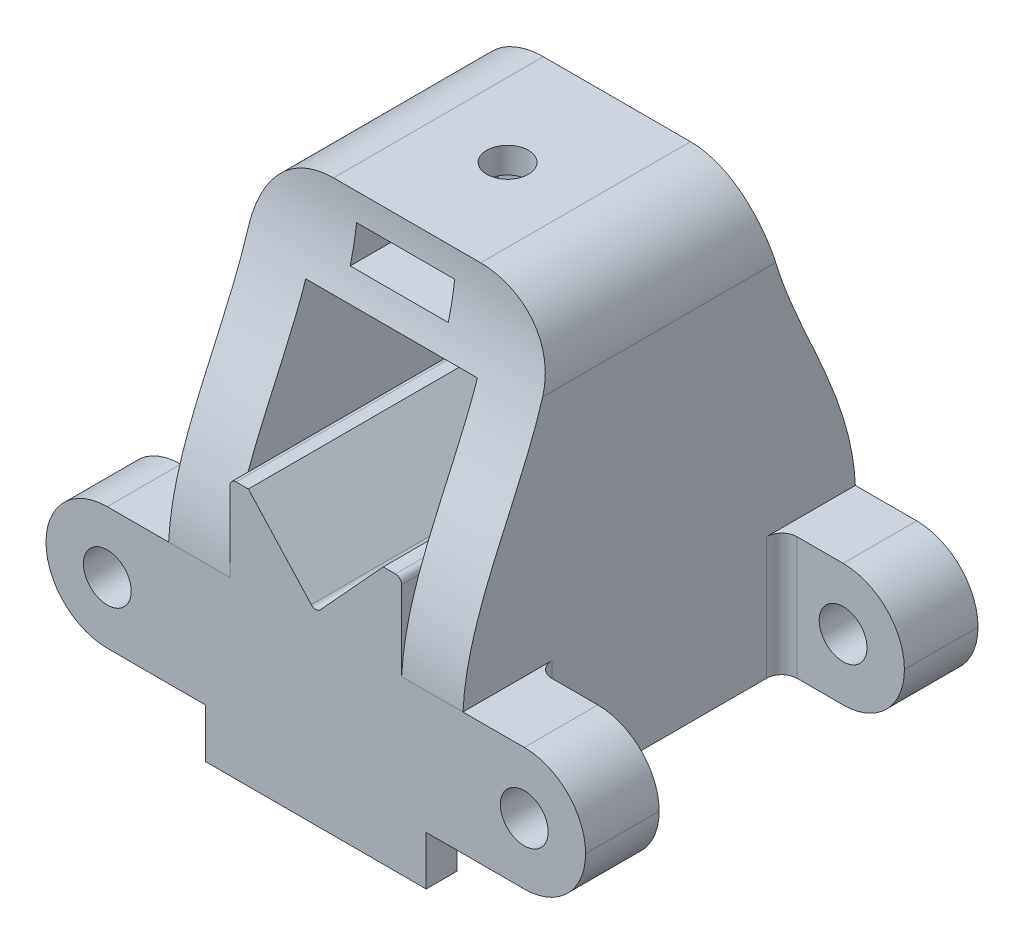
from build123d import *

# Parameters (mm, degrees)
BOSS_EXTRUDE1_DEPTH = 10
SKETCH2_W           = 5
SKETCH2_H           = 32
BOSS_EXTRUDE2_DEPTH = 18
SKETCH3_W           = 24
SKETCH3_H           = 20
BOSS_EXTRUDE3_DEPTH = 7
CUT_EXTRUDE1_DEPTH  = 56.290143787
BOSS_EXTRUDE4_REACH = 56.194
SKETCH7_R           = 1.7
CUT_EXTRUDE2_DEPTH  = 7
SKETCH6_W           = 8
SKETCH6_H           = 2.8
CUT_EXTRUDE3_DEPTH  = 13.34
SKETCH8_R           = 1.95
CUT_EXTRUDE4_DEPTH  = 55.194244669
FILLET1_R           = 5
FILLET2_R           = 1.25
FILLET3_R           = 6
SKETCH9_W           = 18
SKETCH9_H           = 2.5
BOSS_EXTRUDE5_DEPTH = 4
FILLET4_R           = 1


with BuildPart() as part:
    # Sketch1 → Boss-Extrude1 (new body)
    with BuildSketch(Plane(origin=(0, 0, 0), x_dir=(1, 0, 0), z_dir=(0, 1, 0))):
        Polygon((-17.769938204, -26), (-17.769938204, -20), (-7.769938204, -20), (-7.769938204, 0), (-17.769938204, 0), (-17.769938204, 6), (26.230061796, 6), (26.230061796, 0), (16.230061796, 0), (16.230061796, -20), (26.230061796, -20), (26.230061796, -26), align=None)
    extrude(amount=BOSS_EXTRUDE1_DEPTH)

    # Sketch2 → Boss-Extrude2 (add)
    with BuildSketch(Plane(origin=(0, 10, 0), x_dir=(1, 0, 0), z_dir=(0, 1, 0))):
        with Locations((-5.269938204, -10)):
            Rectangle(SKETCH2_W, SKETCH2_H)
        with Locations((13.730061796, -10)):
            Rectangle(SKETCH2_W, SKETCH2_H)
    extrude(amount=BOSS_EXTRUDE2_DEPTH)

    # Sketch3 → Boss-Extrude3 (add)
    with BuildSketch(Plane(origin=(0, 28, 0), x_dir=(1, 0, 0), z_dir=(0, 1, 0))):
        with Locations((4.230061796, -10)):
            Rectangle(SKETCH3_W, SKETCH3_H)
    extrude(amount=BOSS_EXTRUDE3_DEPTH)

    # Sketch4 → Cut-Extrude1 (cut, through all)
    with BuildSketch(Plane(origin=(16.230061796, 0, 0), x_dir=(0, 0, -1), z_dir=(1, 0, 0))):
        with BuildLine():
            Line((-26, 10), (-26, 35))
            Line((-26, 35), (-18.555107994, 35))
            add(Edge.make_bspline(
                [(-26, 10), (-25.555357091, 18.878891188), (-18.529592831, 25.955762579), (-18.555107994, 35)],
                knots=[0, 0, 0, 0, 1, 1, 1, 1], degree=3))
        make_face()
        with BuildLine():
            Line((6, 10), (6, 35))
            Line((6, 35), (-1.444892006, 35))
            add(Edge.make_bspline(
                [(6, 10), (5.555357091, 18.878891188), (-1.470407169, 25.955762579), (-1.444892006, 35)],
                knots=[0, 0, 0, 0, 1, 1, 1, 1], degree=3))
        make_face()
    extrude(amount=-CUT_EXTRUDE1_DEPTH, mode=Mode.SUBTRACT)

    # Boss-Extrude4: up to this face of the body (flat: up to its plane)
    boss_extrude4_end = Plane(part.part.faces().sort_by_distance((4.230061796, 5, -6))[0])
    # Sketch5 → Boss-Extrude4 (add, up to the picked face)
    with BuildSketch(Plane.XY.offset(26), mode=Mode.PRIVATE) as boss_extrude4_sk1:
        with BuildLine():
            Line((-2.769938204, 10), (11.230061796, 10))
            Line((11.230061796, 10), (11.230061796, 16.5))
            ThreePointArc((11.230061796, 16.5), (11.083615187, 16.853553391), (10.730061796, 17))
            Line((10.730061796, 17), (9.730061796, 17))
            Line((9.730061796, 17), (4.598638866, 11.402084076))
            ThreePointArc((4.598638866, 11.402084076), (4.230061796, 11.239946391), (3.861484726, 11.402084076))
            Line((3.861484726, 11.402084076), (-1.269938204, 17))
            Line((-1.269938204, 17), (-2.269938204, 17))
            ThreePointArc((-2.269938204, 17), (-2.623491594, 16.853553391), (-2.769938204, 16.5))
            Line((-2.769938204, 16.5), (-2.769938204, 10))
        make_face()
    boss_extrude4_tool1 = split(extrude(boss_extrude4_sk1.sketch, amount=-BOSS_EXTRUDE4_REACH, mode=Mode.PRIVATE), bisect_by=boss_extrude4_end, keep=Keep.BOTH, mode=Mode.PRIVATE)
    add(boss_extrude4_tool1.solids().sort_by(Axis((-2.613413, 13.25, 26), (0, 0, -1)))[0])

    # Sketch7 → Cut-Extrude2 (cut)
    with BuildSketch(Plane(origin=(0, 35, 0), x_dir=(1, 0, 0), z_dir=(0, 1, 0))):
        with Locations(Location((4.230061796, -10.360107994, 0), (0, 0, 270))):
            Circle(SKETCH7_R)
    extrude(amount=-CUT_EXTRUDE2_DEPTH, mode=Mode.SUBTRACT)

    # Sketch6 → Cut-Extrude3 (cut)
    with BuildSketch(Plane.XY.offset(20.5)):
        with Locations((4.230061796, 31.5)):
            Rectangle(SKETCH6_W, SKETCH6_H)
    extrude(amount=-CUT_EXTRUDE3_DEPTH, mode=Mode.SUBTRACT)

    # Sketch8 → Cut-Extrude4 (cut, through all)
    with BuildSketch(Plane.XY.offset(26)):
        with Locations((21.230061796, 5)):
            Circle(SKETCH8_R)
        with Locations((-12.769938204, 5)):
            Circle(SKETCH8_R)
    extrude(amount=-CUT_EXTRUDE4_DEPTH, mode=Mode.SUBTRACT)

    # Fillet1
    fillet1_edges = [part.edges().sort_by_distance(p)[0] for p in [
        (-17.769938204, 0, -3),
        (-17.769938204, 10, -3),
        (-17.769938204, 0, 23),
        (-17.769938204, 10, 23),
        (26.230061796, 10, -3),
        (26.230061796, 0, -3),
        (26.230061796, 0, 23),
        (26.230061796, 10, 23),
    ]]
    fillet(fillet1_edges, radius=FILLET1_R - 0.0001)  # a hair under: the kernel refuses the full size

    # Fillet2
    fillet2_edges = [part.edges().sort_by_distance(p)[0] for p in [
        (-7.769938204, 5, 20),
        (-7.769938204, 5, 0),
        (16.230061796, 5, 0),
        (16.230061796, 5, 20),
    ]]
    fillet(fillet2_edges, radius=FILLET2_R)

    # Fillet3
    fillet3_edges = [part.edges().sort_by_distance(p)[0] for p in [
        (16.230061796, 35, 10),
        (-7.769938204, 35, 10),
    ]]
    fillet(fillet3_edges, radius=FILLET3_R)

    # Sketch9 → Boss-Extrude5 (add)
    with BuildSketch(Plane.XZ):
        with Locations((4.230061796, 24.75)):
            Rectangle(SKETCH9_W, SKETCH9_H)
    extrude(amount=BOSS_EXTRUDE5_DEPTH)

    # Fillet4
    fillet4_edges = [part.edges().sort_by_distance(p)[0] for p in [
        (4.230061796, 0, 23.5),
    ]]
    fillet(fillet4_edges, radius=FILLET4_R)


solid = part.part
